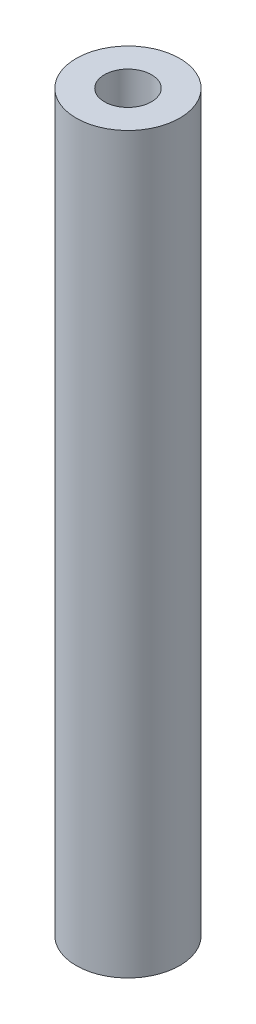
from build123d import *

# Parameters (mm, degrees)
SKETCH1_R           = 5.5
SKETCH1_R_2         = 2.5
BOSS_EXTRUDE1_DEPTH = 78


with BuildPart() as part:
    # Sketch1 → Boss-Extrude1 (new body)
    with BuildSketch(Plane(origin=(0, 0, 0), x_dir=(1, 0, 0), z_dir=(0, 1, 0))):
        Circle(SKETCH1_R)
        Circle(SKETCH1_R_2, mode=Mode.SUBTRACT)
    extrude(amount=BOSS_EXTRUDE1_DEPTH)


solid = part.part
